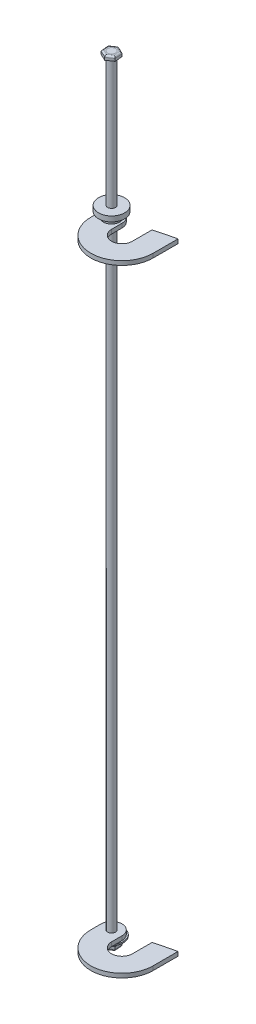
from build123d import *

# Parameters (mm, degrees)
SKETCH1_R              = 2.38125
BOSS_EXTRUDE1_DEPTH    = 236.855
SKETCH2_R              = 2.38125
BOSS_EXTRUDE2_DEPTH    = 2.54
FILLET1_R              = 1
SKETCH3_R              = 7.228116805
SKETCH3_R_2            = 2.38125
BOSS_EXTRUDE3_DEPTH    = 0.79375
SKETCH4_R              = 2.38125
BOSS_EXTRUDE4_DEPTH    = 2.54
CUT_EXTRUDE1_DEPTH     = 19.05
MOVE_START             = -230.98125
MOVE_FACE1_OUTLINE_R   = 2.44475
MOVE_FACE1_OUTLINE_R_2 = 2.38125
MOVE_FACE1_DEPTH       = 2.54
SKETCH7_R              = 5.08
SKETCH7_R_2            = 2.38125
BOSS_EXTRUDE6_DEPTH    = 3.175
BOSS_EXTRUDE7_START    = 3.175
SKETCH8_R              = 8
SKETCH8_R_2            = 2.38125
BOSS_EXTRUDE7_DEPTH    = 3.175


# Read off the part's stored shape, not the designer's step: Move Face1
with BuildPart() as part:
    # Sketch1 → Boss-Extrude1 (new, symmetric)
    with BuildSketch(Plane(origin=(0, 0, 0), x_dir=(1, 0, 0), z_dir=(0, 1, 0))):
        with Locations(Location((0, 0, 0), (0, 0, 270))):
            Circle(SKETCH1_R)
    extrude(amount=BOSS_EXTRUDE1_DEPTH, both=True)


with BuildPart() as body_2:
    # Sketch2 → Boss-Extrude2 (new body)
    with BuildSketch(Plane(origin=(0, 236.855, 0), x_dir=(1, 0, 0), z_dir=(0, 1, 0))):
        Polygon((3.767272711, 2.609398093), (-0.376168682, 4.567252917), (-4.143441392, 1.957854824), (-3.767272711, -2.609398093), (0.376168682, -4.567252917), (4.143441392, -1.957854824), align=None)
        with Locations(Location((0, 0, 0), (0, 0, 270))):
            Circle(SKETCH2_R, mode=Mode.SUBTRACT)
    extrude(amount=-BOSS_EXTRUDE2_DEPTH)

    # Fillet1
    fillet1_edges = [body_2.edges().sort_by_distance(p)[0] for p in [
        (2.259805037, 236.855, 3.26255387),
        (-1.695552014, 236.855, 3.588325505),
        (-3.955357051, 236.855, 0.325771635),
        (-2.259805037, 236.855, -3.26255387),
        (1.695552014, 236.855, -3.588325505),
        (3.955357051, 236.855, -0.325771635),
    ]]
    fillet(fillet1_edges, radius=FILLET1_R)


with BuildPart() as body_3:
    # Mirror1: mirrored copy
    add(body_2.part.mirror(Plane.ZX))


with BuildPart() as body_4:
    # Sketch3 → Boss-Extrude3 (new body)
    with BuildSketch(Plane(origin=(0, -231.775, 0), x_dir=(1, 0, 0), z_dir=(0, 1, 0))):
        with Locations(Location((0, 0, 0), (0, 0, 270))):
            Circle(SKETCH3_R)
        with Locations(Location((0, 0, 0), (0, 0, 270))):
            Circle(SKETCH3_R_2, mode=Mode.SUBTRACT)
    extrude(amount=BOSS_EXTRUDE3_DEPTH)


with BuildPart() as body_5:
    # Sketch4 → Boss-Extrude4 (new body)
    with BuildSketch(Plane(origin=(0, -230.98125, 0), x_dir=(1, 0, 0), z_dir=(0, 1, 0))):
        with BuildLine():
            Line((6.35, 0), (6.35, -6.35))
            ThreePointArc((6.35, -6.35), (12.7, -12.7), (19.05, -6.35))
            Line((19.05, -6.35), (19.05, 13.900226486))
            Line((19.05, 13.900226486), (31.75, 13.900226486))
            Line((31.75, 13.900226486), (31.75, -6.35))
            ThreePointArc((31.75, -6.35), (12.7, -25.4), (-6.35, -6.35))
            Line((-6.35, -6.35), (-6.35, 0))
            ThreePointArc((-6.35, 0), (0, 6.35), (6.35, 0))
        make_face()
        with Locations(Location((0, 0, 0), (0, 0, 270))):
            Circle(SKETCH4_R, mode=Mode.SUBTRACT)
    extrude(amount=BOSS_EXTRUDE4_DEPTH)

    # Sketch5 → Cut-Extrude1 (cut)
    with BuildSketch(Plane.XZ.offset(230.98125)):
        with BuildLine():
            Line((19.05, -5.644264501), (19.05, -13.900226486))
            Line((19.05, -13.900226486), (31.75, -13.900226486))
            Line((31.75, -13.900226486), (31.75, -8.851150591))
            ThreePointArc((31.75, -8.851150591), (25.378745016, -7.331882129), (19.05, -5.644264501))
        make_face()
    extrude(amount=-CUT_EXTRUDE1_DEPTH, mode=Mode.SUBTRACT)

    # Move Face1 outline → Move Face1 (cut)
    with BuildSketch(Plane(origin=(0, 0, 0), x_dir=(1, 0, 0), z_dir=(0, 1, 0)).offset(MOVE_START)):
        Circle(MOVE_FACE1_OUTLINE_R)
        Circle(MOVE_FACE1_OUTLINE_R_2, mode=Mode.SUBTRACT)
    extrude(amount=MOVE_FACE1_DEPTH, mode=Mode.SUBTRACT)


with BuildPart() as body_6:
    # Body-Move/Copy1: copy of body 5
    add(body_5.part.moved(Location((0, 377.19, 0))))


with BuildPart() as body_7:
    # Sketch7 → Boss-Extrude6 (new body)
    with BuildSketch(Plane(origin=(0, 148.74875, 0), x_dir=(1, 0, 0), z_dir=(0, 1, 0))):
        with Locations(Location((0, 0, 0), (0, 0, 270))):
            Circle(SKETCH7_R)
        with Locations(Location((0, 0, 0), (0, 0, 270))):
            Circle(SKETCH7_R_2, mode=Mode.SUBTRACT)
    extrude(amount=BOSS_EXTRUDE6_DEPTH)

    # Sketch8 → Boss-Extrude7 (add)
    with BuildSketch(Plane(origin=(0, 151.92375, 0), x_dir=(1, 0, 0), z_dir=(0, 1, 0)).offset(BOSS_EXTRUDE7_START)):
        with Locations(Location((0, 0, 0), (0, 0, 270))):
            Circle(SKETCH8_R)
        with Locations(Location((0, 0, 0), (0, 0, 270))):
            Circle(SKETCH8_R_2, mode=Mode.SUBTRACT)
    extrude(amount=-BOSS_EXTRUDE7_DEPTH)


solid = Compound([part.part, body_2.part, body_3.part, body_4.part, body_5.part, body_6.part, body_7.part])
